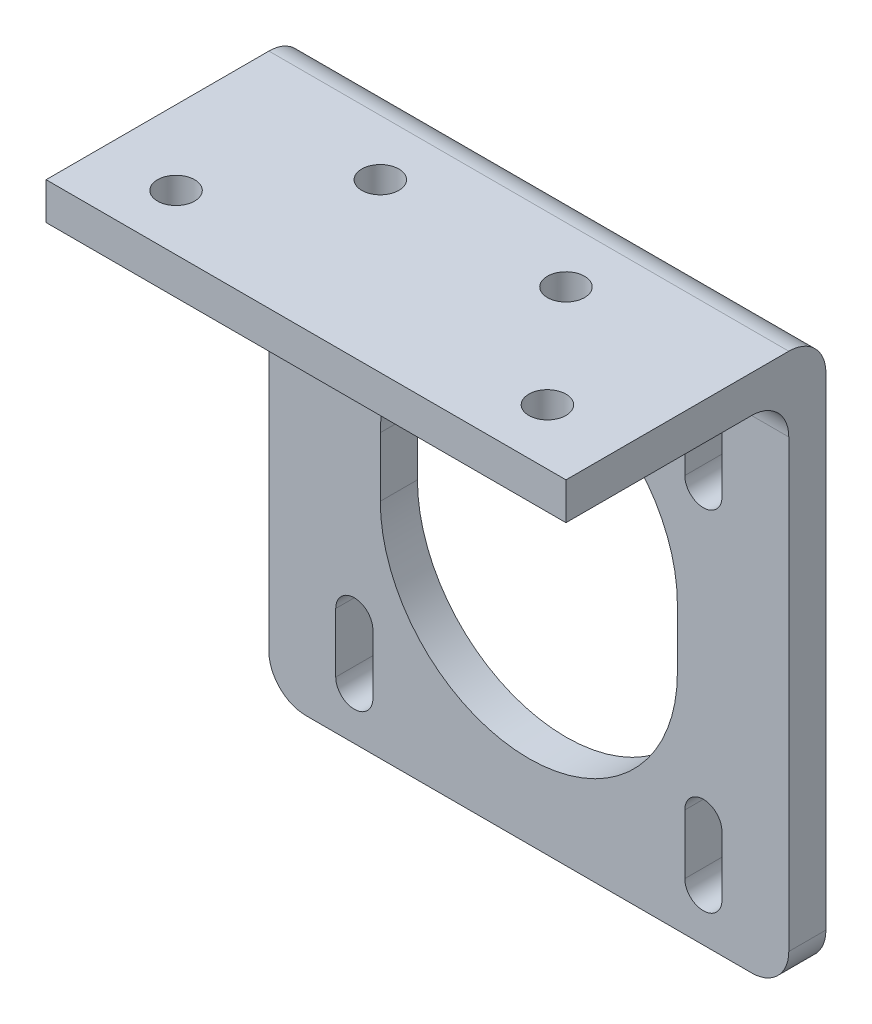
from build123d import *

# Parameters (mm, degrees)
BOSS_EXTRUDE1_DEPTH = 5
CUT_EXTRUDE1_DEPTH  = 52.53882032022076
BOSS_EXTRUDE2_DEPTH = 30
SKETCH5_R           = 2.4999999999999987
SKETCH5_R_2         = 2.4999999999999982
CUT_EXTRUDE2_DEPTH  = 30
FILLET1_R           = 5


with BuildPart() as part:
    # Sketch2 → Boss-Extrude1 (new body)
    with BuildSketch(Plane.XY):
        with BuildLine():
            Line((-29.999999999999975, -37.499999999999986), (30, -37.499999999999986))
            ThreePointArc((30, -37.499999999999986), (33.53553390593274, -36.03553390593272), (35, -32.499999999999986))
            Line((35, -32.499999999999986), (35, 37.5))
            Line((35, 37.5), (-34.99999999999998, 37.5))
            Line((-34.99999999999998, 37.5), (-34.99999999999998, -32.499999999999986))
            ThreePointArc((-34.99999999999998, -32.499999999999986), (-33.53553390593271, -36.03553390593272), (-29.999999999999975, -37.499999999999986))
        make_face()
    extrude(amount=BOSS_EXTRUDE1_DEPTH)

    # Sketch3 → Cut-Extrude1 (cut, through all)
    with BuildSketch(Plane.XY.offset(5)):
        with BuildLine():
            Line((-21.000000000000007, 24), (-21.000000000000007, 16))
            ThreePointArc((-21.000000000000007, 16), (-23.500000000000007, 13.500000000000018), (-25.99999999999999, 16))
            Line((-25.99999999999999, 16), (-25.99999999999999, 24))
            ThreePointArc((-25.99999999999999, 24), (-23.500000000000007, 26.5), (-21.000000000000007, 24))
        make_face()
        with BuildLine():
            Line((-20.999999999999993, -23), (-20.999999999999993, -31))
            ThreePointArc((-20.999999999999993, -31), (-23.499999999999996, -33.5), (-25.999999999999996, -31))
            Line((-25.999999999999996, -31), (-25.999999999999996, -23))
            ThreePointArc((-25.999999999999996, -23), (-23.499999999999996, -20.499999999999996), (-20.999999999999993, -23))
        make_face()
        with BuildLine():
            Line((25.999999999999993, 24), (25.999999999999993, 16))
            ThreePointArc((25.999999999999993, 16), (23.499999999999993, 13.500000000000018), (21.00000000000001, 16))
            Line((21.00000000000001, 16), (21.00000000000001, 24))
            ThreePointArc((21.00000000000001, 24), (23.499999999999993, 26.5), (25.999999999999993, 24))
        make_face()
        with BuildLine():
            Line((26.000000000000007, -23), (26.000000000000007, -31))
            ThreePointArc((26.000000000000007, -31), (23.500000000000004, -33.5), (21.000000000000004, -31))
            Line((21.000000000000004, -31), (21.000000000000004, -23))
            ThreePointArc((21.000000000000004, -23), (23.500000000000004, -20.499999999999996), (26.000000000000007, -23))
        make_face()
        with BuildLine():
            Line((20.000000000000004, 0.49999999999999784), (20.000000000000004, -7.499999999999997))
            ThreePointArc((20.000000000000004, -7.499999999999997), (1.22e-15, -27.500000000000004), (-20.000000000000004, -7.500000000000003))
            Line((-20.000000000000004, -7.500000000000003), (-20.000000000000004, 0.500000000000003))
            ThreePointArc((-20.000000000000004, 0.500000000000003), (5.67e-15, 20.500000000000004), (20.000000000000004, 0.49999999999999784))
        make_face()
    extrude(amount=-CUT_EXTRUDE1_DEPTH, mode=Mode.SUBTRACT)

    # Sketch4 → Boss-Extrude2 (add)
    with BuildSketch(Plane.XY.offset(5)):
        Polygon((-34.99999999999998, 37.5), (-34.99999999999998, 32.5), (35, 32.5), (35, 37.49999999999999), align=None)
    extrude(amount=BOSS_EXTRUDE2_DEPTH)

    # Sketch5 → Cut-Extrude2 (cut)
    with BuildSketch(Plane.XZ.offset(-32.5)):
        with Locations((-12.5, 12.5)):
            Circle(SKETCH5_R)
        with Locations((12.5, 12.5)):
            Circle(SKETCH5_R)
        with Locations((-25, 27.5)):
            Circle(SKETCH5_R_2)
        with Locations((25, 27.5)):
            Circle(SKETCH5_R_2)
    extrude(amount=-CUT_EXTRUDE2_DEPTH, mode=Mode.SUBTRACT)

    # Fillet1
    fillet1_edges = [part.edges().sort_by_distance(p)[0] for p in [
        (7.11e-15, 32.5, 5),
        (1.421e-14, 37.5, 0),
    ]]
    fillet(fillet1_edges, radius=FILLET1_R)


solid = part.part
